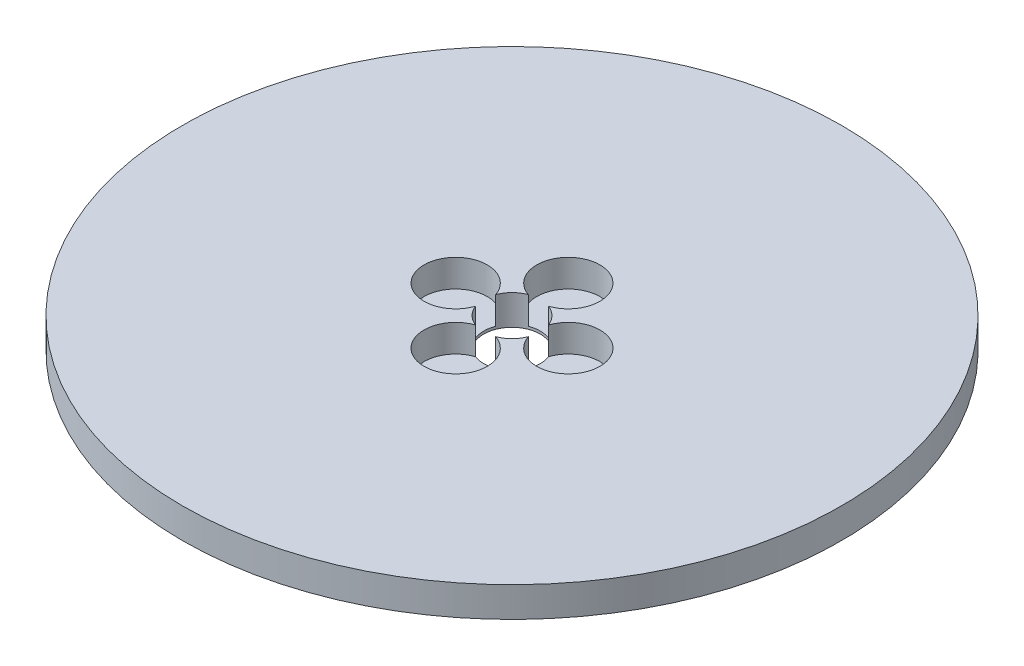
from build123d import *

# Parameters (mm, degrees)
SKETCH1_R           = 87.5
BOSS_EXTRUDE1_DEPTH = 8
SKETCH2_R           = 7.5
CUT_EXTRUDE1_DEPTH  = 125.002016113
SKETCH3_R           = 8.388322214
CUT_EXTRUDE2_DEPTH  = 7.293089296
CIRPATTERN1_COUNT   = 4


with BuildPart() as part:
    # Sketch1 → Boss-Extrude1 (new body)
    with BuildSketch(Plane(origin=(0, 0, 0), x_dir=(1, 0, 0), z_dir=(0, 1, 0))):
        Circle(SKETCH1_R)
    extrude(amount=BOSS_EXTRUDE1_DEPTH)

    # Sketch2 → Cut-Extrude1 (cut, through all)
    with BuildSketch(Plane(origin=(0, 0, 0), x_dir=(1, 0, 0), z_dir=(0, 1, 0))):
        Circle(SKETCH2_R)
    extrude(amount=CUT_EXTRUDE1_DEPTH, mode=Mode.SUBTRACT)

    # Sketch3 → Cut-Extrude2 (cut)
    with BuildSketch(Plane(origin=(0, 8, 0), x_dir=(1, 0, 0), z_dir=(0, 1, 0))):
        with Locations((-14.953666682, 0)):
            Circle(SKETCH3_R)
    cut_extrude2 = extrude(amount=-CUT_EXTRUDE2_DEPTH, mode=Mode.SUBTRACT)

    # CirPattern1: Cut-Extrude2 ×4 about axis
    cirpattern1_axis = Axis((0, 0, 0), (0, 1, 0))
    for i in range(1, CIRPATTERN1_COUNT):
        add(cut_extrude2.rotate(cirpattern1_axis, i * 360 / CIRPATTERN1_COUNT), mode=Mode.SUBTRACT)


solid = part.part
